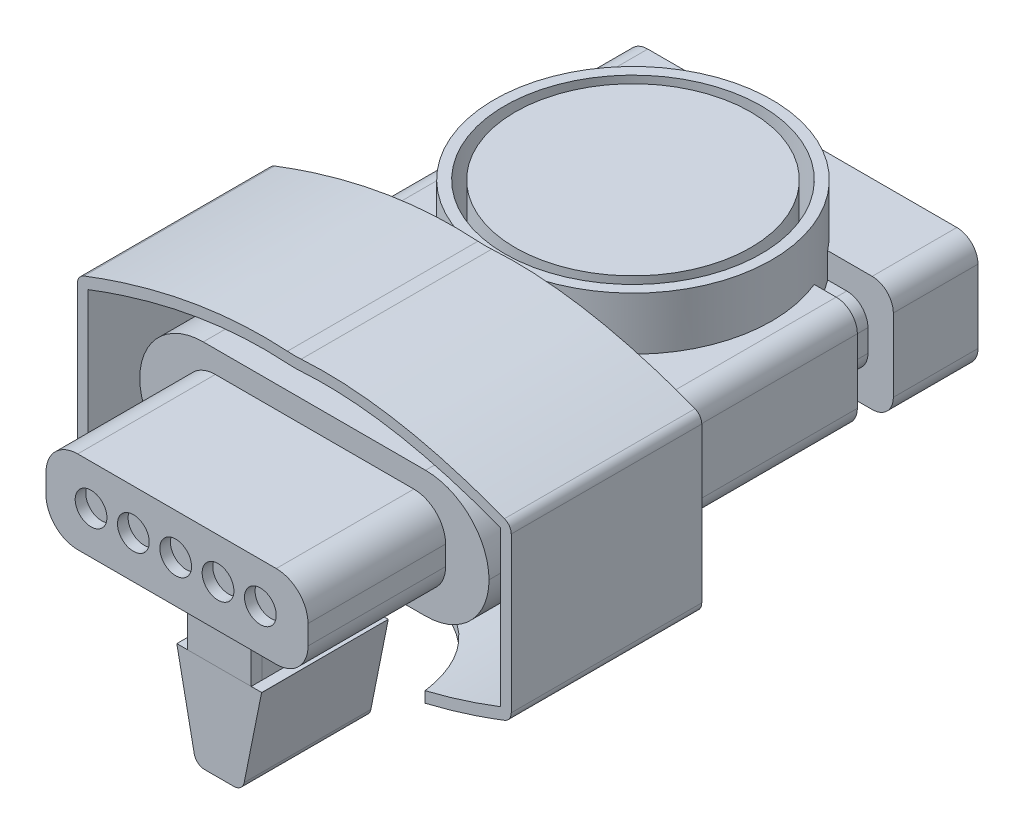
from build123d import *

# Parameters (mm, degrees)
SKETCH_1_W           = 33.2
SKETCH_1_H           = 10.9
EXTRUDE_1_DEPTH      = 8
SKETCH_2_W           = 28.4
SKETCH_2_H           = 6.1
EXTRUDE_2_DEPTH      = 3
SKETCH_3_W           = 32.4
SKETCH_3_H           = 10.1
EXTRUDE_3_DEPTH      = 19
EXTRUDE_4_DEPTH      = 18
FILLET_1_R           = 10
CUT_EXTRUDE_1_DEPTH  = 15
CUT_EXTRUDE_2_DEPTH  = 15
SKETCH_7_W           = 33.001084038
SKETCH_7_H           = 11.935474502
EXTRUDE_5_DEPTH      = 13
FILLET_2_R           = 6
SKETCH_8_W           = 24.75557866
SKETCH_8_H           = 7.841319277
EXTRUDE_6_DEPTH      = 13
FILLET_3_R           = 3
EXTRUDE_7_DEPTH      = 2
EXTRUDE_8_DEPTH      = 5
EXTRUDE_9_DEPTH      = 9
CUT_EXTRUDE_7_DEPTH  = 13
FILLET_4_R           = 1
FILLET_5_R           = 1
FILLET_6_R           = 2
SKETCH_14_R          = 13.117732225
EXTRUDE_15_DEPTH     = 7
SKETCH_15_R          = 12.117732225
SKETCH_15_R_2        = 11.117732225
CUT_EXTRUDE_8_DEPTH  = 7
SKETCH_16_R          = 2
CUT_EXTRUDE_9_DEPTH  = 1
SKETCH_17_R          = 1.5
CUT_EXTRUDE_10_DEPTH = 1


with BuildPart() as part:
    # ｽｹｯﾁ1 → ﾎﾞｽ - 押し出し1 (new body)
    with BuildSketch(Plane.XY):
        with Locations((16.6, 5.45)):
            Rectangle(SKETCH_1_W, SKETCH_1_H)
    extrude(amount=EXTRUDE_1_DEPTH)

    # ｽｹｯﾁ2 → ﾎﾞｽ - 押し出し2 (add)
    with BuildSketch(Plane.XY.offset(8)):
        with Locations((16.6, 5.45)):
            Rectangle(SKETCH_2_W, SKETCH_2_H)
    extrude(amount=EXTRUDE_2_DEPTH)

    # ｽｹｯﾁ3 → ﾎﾞｽ - 押し出し3 (add)
    with BuildSketch(Plane.XY.offset(11)):
        with Locations((16.6, 5.45)):
            Rectangle(SKETCH_3_W, SKETCH_3_H)
    extrude(amount=EXTRUDE_3_DEPTH)

    # ｽｹｯﾁ4 → ﾎﾞｽ - 押し出し4 (add)
    with BuildSketch(Plane.XY.offset(30)):
        with BuildLine():
            Line((-3.9, -2.55), (-3.9, 13.45))
            add(Edge.make_bspline(
                [(16.6, 17.1), (9.592880396, 17.696713652), (2.574069819, 16.014035367), (-3.9, 13.45)],
                knots=[0, 0, 0, 0, 1, 1, 1, 1], degree=3))
            add(Edge.make_bspline(
                [(16.6, 17.1), (23.607119604, 17.696713652), (30.625930181, 16.014035367), (37.1, 13.45)],
                knots=[0, 0, 0, 0, 1, 1, 1, 1], degree=3))
            Line((37.1, 13.45), (37.1, -2.55))
            add(Edge.make_bspline(
                [(16.6, -6.2), (23.607119604, -6.796713652), (30.625930181, -5.114035367), (37.1, -2.55)],
                knots=[0, 0, 0, 0, 1, 1, 1, 1], degree=3))
            add(Edge.make_bspline(
                [(16.6, -6.2), (9.592880396, -6.796713652), (2.574069819, -5.114035367), (-3.9, -2.55)],
                knots=[0, 0, 0, 0, 1, 1, 1, 1], degree=3))
        make_face()
    extrude(amount=EXTRUDE_4_DEPTH)

    # ﾌｨﾚｯﾄ1
    fillet_1_edges = [part.edges().sort_by_distance(p)[0] for p in [
        (16.6, 17.1, 39),
        (16.6, -6.2, 39),
    ]]
    fillet(fillet_1_edges, radius=FILLET_1_R)

    # ｽｹｯﾁ5 → ｶｯﾄ - 押し出し1 (cut)
    with BuildSketch(Plane.XY.offset(48)):
        with BuildLine():
            Line((-2.9, 12.766921095), (-2.9, -1.866921095))
            add(Edge.make_bspline(
                [(-2.9, -1.866921095), (-1.401032659, -2.443660781), (0.11596502, -2.966837844), (3.194529473, -3.880790801), (4.752231696, -4.270324824), (7.115488398, -4.728984232), (7.908815983, -4.861004753), (9.496057427, -5.07742645), (10.291012603, -5.162074448), (12.680218663, -5.339376433), (14.278791904, -5.355709317), (15.884219057, -5.251020701)],
                knots=[0, 0, 0, 0, 0.25, 0.25, 0.5, 0.5, 0.625, 0.625, 0.75, 0.75, 1, 1, 1, 1], degree=3))
            ThreePointArc((15.884219057, -5.251020701), (16.6, -5.227707708), (17.315780943, -5.251020701))
            add(Edge.make_bspline(
                [(17.315780943, -5.251020701), (18.919238693, -5.355580893), (20.520978128, -5.339660556), (22.921379304, -5.160966864), (23.720284766, -5.075532004), (25.308631525, -4.858284766), (26.099169807, -4.726398416), (27.673633183, -4.420304759), (28.458106126, -4.245916769), (30.014053595, -3.860381365), (30.786372375, -3.649098558), (33.088089168, -2.965353745), (34.602301739, -2.443172492), (36.1, -1.866921095)],
                knots=[0, 0, 0, 0, 0.25, 0.25, 0.375, 0.375, 0.5, 0.5, 0.625, 0.625, 0.75, 0.75, 1, 1, 1, 1], degree=3))
            Line((36.1, -1.866921095), (36.1, 12.766921095))
            add(Edge.make_bspline(
                [(36.1, 12.766921095), (34.601032659, 13.343660781), (33.08403498, 13.866837844), (30.005470527, 14.780790801), (28.447768304, 15.170324824), (26.084511602, 15.628984232), (25.291184017, 15.761004753), (23.703942573, 15.97742645), (22.908987397, 16.062074448), (20.519781337, 16.239376433), (18.921208096, 16.255709317), (17.315780943, 16.151020701)],
                knots=[0, 0, 0, 0, 0.25, 0.25, 0.5, 0.5, 0.625, 0.625, 0.75, 0.75, 1, 1, 1, 1], degree=3))
            ThreePointArc((17.315780943, 16.151020701), (16.6, 16.127707708), (15.884219057, 16.151020701))
            add(Edge.make_bspline(
                [(15.884219057, 16.151020701), (14.280761307, 16.255580893), (12.679021872, 16.239660556), (10.278620696, 16.060966864), (9.479715234, 15.975532004), (7.891368475, 15.758284766), (7.100830193, 15.626398416), (5.526366817, 15.320304759), (4.741893874, 15.145916769), (3.185946405, 14.760381365), (2.413627625, 14.549098558), (0.111910832, 13.865353745), (-1.402301739, 13.343172492), (-2.9, 12.766921095)],
                knots=[0, 0, 0, 0, 0.25, 0.25, 0.375, 0.375, 0.5, 0.5, 0.625, 0.625, 0.75, 0.75, 1, 1, 1, 1], degree=3))
        make_face()
    extrude(amount=-CUT_EXTRUDE_1_DEPTH, mode=Mode.SUBTRACT)

    # ｽｹｯﾁ6 → ｶｯﾄ - 押し出し2 (cut)
    with BuildSketch(Plane(origin=(0, 0, 0), x_dir=(1, 0, 0), z_dir=(0, 1, 0))):
        with BuildLine():
            Line((4.144792972, -50.164095447), (29.144792972, -50.164095447))
            ThreePointArc((29.144792972, -50.164095447), (16.644792972, -37.664095447), (4.144792972, -50.164095447))
        make_face()
    extrude(amount=-CUT_EXTRUDE_2_DEPTH, mode=Mode.SUBTRACT)

    # ｽｹｯﾁ7 → ﾎﾞｽ - 押し出し5 (add)
    with BuildSketch(Plane.XY.offset(33)):
        with Locations((16.500542019, 5.967737251)):
            Rectangle(SKETCH_7_W, SKETCH_7_H)
    extrude(amount=EXTRUDE_5_DEPTH)

    # ﾌｨﾚｯﾄ2
    # the kernel refuses this fillet: 6 mm, written as the material it takes off along each edge
    with BuildSketch(Plane(origin=(0, 11.935474502, 33), x_dir=(1, 0, 0), z_dir=(0, 0, 1)), Plane(origin=(33.001084038, 11.935474502, 33), x_dir=(0, -1, 0), z_dir=(0, 0, 1)), Plane(origin=(33.001084038, 0, 33), x_dir=(-1, 0, 0), z_dir=(0, 0, 1))) as fillet_2_piece_1:
        with BuildLine():
            CenterArc((FILLET_2_R, -FILLET_2_R), FILLET_2_R, 90, 90)
            Line((0, -FILLET_2_R), (0, 0))
            Line((0, 0), (FILLET_2_R, 0))
        make_face()
    extrude(amount=28, mode=Mode.SUBTRACT)
    with BuildSketch(Plane(origin=(0, 0, 33), x_dir=(1, 0, 0), z_dir=(0, 0, 1))) as fillet_2_piece_2:
        with BuildLine():
            CenterArc((FILLET_2_R, FILLET_2_R), FILLET_2_R, 180, 90)
            Line((0, FILLET_2_R), (0, 0))
            Line((0, 0), (FILLET_2_R, 0))
        make_face()
    extrude(amount=28, mode=Mode.SUBTRACT)

    # ｽｹｯﾁ8 → ﾎﾞｽ - 押し出し6 (add)
    with BuildSketch(Plane.XY.offset(46)):
        with Locations((16.517891945, 5.921059454)):
            Rectangle(SKETCH_8_W, SKETCH_8_H)
    extrude(amount=EXTRUDE_6_DEPTH)

    # ﾌｨﾚｯﾄ3
    fillet_3_edges = [part.edges().sort_by_distance(p)[0] for p in [
        (4.140102615, 9.841719093, 52.5),
        (4.140102615, 2.000399816, 52.5),
        (28.895681275, 2.000399816, 52.5),
        (28.895681275, 9.841719093, 52.5),
    ]]
    fillet(fillet_3_edges, radius=FILLET_3_R)

    # ｽｹｯﾁ9 → ﾎﾞｽ - 押し出し7 (add)
    with BuildSketch(Plane.XZ.offset(-2.000399816)):
        Polygon((16.500542019, 46), (12.500542019, 46), (12.500542019, 55), (16.512553506, 55), (20.524550701, 54.98929108), (20.500527769, 45.989323141), align=None)
    extrude(amount=EXTRUDE_7_DEPTH)

    # ｽｹｯﾁ10 → ﾎﾞｽ - 押し出し8 (add)
    with BuildSketch(Plane.XZ.offset(-0.000399816)):
        Polygon((13.500542019, 54), (13.500542019, 55), (19.521885049, 54.99196742), (19.521885049, 53.991963857), (19.50322193, 47), (19.50322193, 43.108732797), (13.500542019, 43.108732797), (13.500542019, 47), align=None)
    extrude(amount=EXTRUDE_8_DEPTH)

    # ｽｹｯﾁ11 → ﾎﾞｽ - 押し出し9 (add)
    with BuildSketch(Plane.XZ.offset(4.999600184)):
        Polygon((12.500542019, 55), (20.521885049, 54.990631769), (20.521885049, 53.990629248), (20.50322193, 46.99866539), (20.50322193, 43.023961158), (12.500542019, 43.023961158), align=None)
    extrude(amount=EXTRUDE_9_DEPTH)

    # ｽｹｯﾁ12 → ｶｯﾄ - 押し出し7 (cut)
    with BuildSketch(Plane(origin=(0, 0, 43.023961158), x_dir=(-1, 0, 0), z_dir=(0, 0, -1))):
        Polygon((-18.697992664, -13.999600184), (-20.50322193, -4.999600184), (-22.567158866, -6.856036875), (-22.567158866, -13.999600184), align=None)
        Polygon((-14.305771285, -13.999600184), (-12.500542019, -13.999600184), (-12.500542019, -4.999600184), align=None)
    extrude(amount=-CUT_EXTRUDE_7_DEPTH, mode=Mode.SUBTRACT)


with BuildPart() as cut_extrude_7_piece_1:
    # of the separate pieces the step leaves, piece 1, a body of its own (cut_extrude_7_pieces)
    add(part.part.solids().sort_by_distance((8.6741e-05, 5.967737251, 46))[0])

    # ﾌｨﾚｯﾄ4
    fillet_4_edges = [cut_extrude_7_piece_1.edges().sort_by_distance(p)[0] for p in [
        (18.697992664, -13.999600184, 49.008361537),
        (14.305771285, -13.999600184, 49.010926403),
    ]]
    fillet(fillet_4_edges, radius=FILLET_4_R)

    # ﾌｨﾚｯﾄ5
    fillet_5_edges = [cut_extrude_7_piece_1.edges().sort_by_distance(p)[0] for p in [
        (37.1, -2.55, 39),
        (37.1, 13.45, 39),
        (-3.9, 13.45, 39),
        (-3.9, -2.55, 39),
    ]]
    fillet(fillet_5_edges, radius=FILLET_5_R)

    # ﾌｨﾚｯﾄ6
    fillet_6_edges = [cut_extrude_7_piece_1.edges().sort_by_distance(p)[0] for p in [
        (0, 10.9, 4),
        (0, 0, 4),
        (33.2, 0, 4),
        (33.2, 10.9, 4),
        (30.8, 8.5, 9.5),
        (2.4, 8.5, 9.5),
        (2.4, 2.4, 9.5),
        (30.8, 2.4, 9.5),
        (32.8, 0.4, 20.5),
        (32.8, 10.5, 20.5),
        (0.4, 10.5, 20.5),
        (0.4, 0.4, 20.5),
    ]]
    fillet(fillet_6_edges, radius=FILLET_6_R)

    # ｽｹｯﾁ14 → ﾎﾞｽ - 押し出し15 (add)
    with BuildSketch(Plane(origin=(0, 8.5, 0), x_dir=(1, 0, 0), z_dir=(0, 1, 0))):
        with Locations(Location((16.6, -16, 0), (0, 0, 37.579490007))):
            Circle(SKETCH_14_R)
    extrude(amount=EXTRUDE_15_DEPTH)

    # ｽｹｯﾁ15 → ｶｯﾄ - 押し出し8 (cut)
    with BuildSketch(Plane(origin=(0, 15.5, 0), x_dir=(1, 0, 0), z_dir=(0, 1, 0))):
        with Locations(Location((16.6, -16, 0), (0, 0, 270))):
            Circle(SKETCH_15_R)
        with Locations(Location((16.6, -16, 0), (0, 0, 270))):
            Circle(SKETCH_15_R_2, mode=Mode.SUBTRACT)
    extrude(amount=-CUT_EXTRUDE_8_DEPTH, mode=Mode.SUBTRACT)

    # ｽｹｯﾁ16 → ｶｯﾄ - 押し出し9 (cut)
    with BuildSketch(Plane(origin=(0, 0, 0), x_dir=(-1, 0, 0), z_dir=(0, 0, -1))):
        with Locations((-16.6, 6)):
            Circle(SKETCH_16_R)
        with Locations((-11.6, 6)):
            Circle(SKETCH_16_R)
        with Locations((-21.6, 6)):
            Circle(SKETCH_16_R)
        with Locations((-26.6, 6)):
            Circle(SKETCH_16_R)
        with Locations((-6.6, 6)):
            Circle(SKETCH_16_R)
    extrude(amount=-CUT_EXTRUDE_9_DEPTH, mode=Mode.SUBTRACT)

    # ｽｹｯﾁ17 → ｶｯﾄ - 押し出し10 (cut)
    with BuildSketch(Plane.XY.offset(59)):
        with Locations((16.395681275, 6.000399816)):
            Circle(SKETCH_17_R)
        with Locations((20.395681275, 6.000399816)):
            Circle(SKETCH_17_R)
        with Locations((24.395681275, 6.000399816)):
            Circle(SKETCH_17_R)
        with Locations((12.395681275, 6.000399816)):
            Circle(SKETCH_17_R)
        with Locations((8.395681275, 6.000399816)):
            Circle(SKETCH_17_R)
    extrude(amount=-CUT_EXTRUDE_10_DEPTH, mode=Mode.SUBTRACT)


with BuildPart() as cut_extrude_7_piece_2:
    # of the separate pieces the step leaves, piece 2, a body of its own (cut_extrude_7_pieces)
    add(part.part.solids().sort_by_distance((20.521885049, -4.999600184, 53.990629248))[0])


solid = Compound([cut_extrude_7_piece_1.part, cut_extrude_7_piece_2.part])
